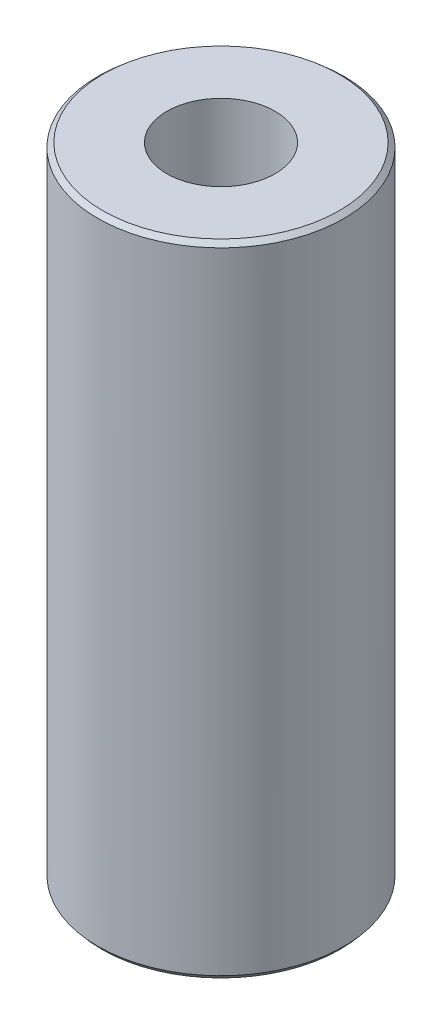
from build123d import *
from OCP.BRepFilletAPI import BRepFilletAPI_MakeChamfer

# Parameters (mm, degrees)
SKETCH1_R           = 40
BOSS_EXTRUDE1_DEPTH = 207.799958914
SKETCH2_R           = 17.600593878
CUT_EXTRUDE1_DEPTH  = 216.362074016
CHAMFER1_SIZE       = 1.375733232
CHAMFER1_SIZE2      = 1.595794624


with BuildPart() as part:
    # Sketch1 → Boss-Extrude1 (new body)
    with BuildSketch(Plane(origin=(0, 0, 0), x_dir=(1, 0, 0), z_dir=(0, 1, 0))):
        Circle(SKETCH1_R)
    extrude(amount=BOSS_EXTRUDE1_DEPTH)

    # Sketch2 → Cut-Extrude1 (cut, through all)
    with BuildSketch(Plane(origin=(0, 0, 0), x_dir=(1, 0, 0), z_dir=(0, 1, 0))):
        Circle(SKETCH2_R)
    extrude(amount=CUT_EXTRUDE1_DEPTH, mode=Mode.SUBTRACT)

    # Chamfer1: one chamfer whose edges measure the first distance from different faces: ONE call of the kernel's chamfer builder (chamfer() names one face for all edges)
    chamfer1_edges_1 = [part.edges().sort_by_distance(p)[0] for p in [
        (-40, 207.799958914, 0),
    ]]
    chamfer1_side_1 = [part.faces().sort_by_distance(p)[0] for p in [
        (-40, 103.899979457, 0),
    ]]
    chamfer1_edges_2 = [part.edges().sort_by_distance(p)[0] for p in [
        (-40, 0, 0),
    ]]
    chamfer1_side_2 = [part.faces().sort_by_distance(p)[0] for p in [
        (-38.86862915, 0, 0),
    ]]
    chamfer1 = BRepFilletAPI_MakeChamfer(part.part.solid().wrapped)
    for e in chamfer1_edges_1:
        chamfer1.Add(CHAMFER1_SIZE, CHAMFER1_SIZE2, e.wrapped, chamfer1_side_1[0].wrapped)  # the first distance lies on this face
    for e in chamfer1_edges_2:
        chamfer1.Add(CHAMFER1_SIZE, CHAMFER1_SIZE2, e.wrapped, chamfer1_side_2[0].wrapped)  # the first distance lies on this face
    add(Compound.cast(chamfer1.Shape()), mode=Mode.REPLACE)


solid = part.part
